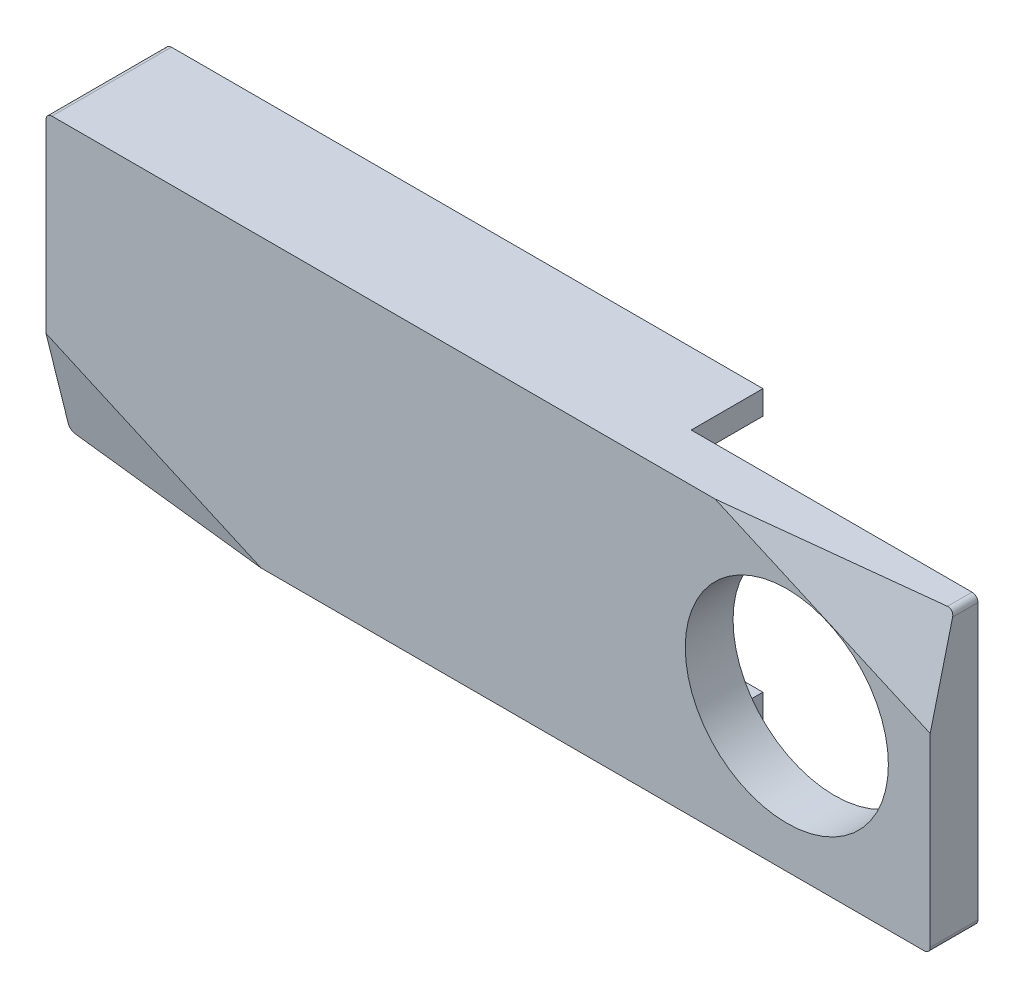
from build123d import *

# Parameters (mm, degrees)
SKETCH_1_W          = 74
SKETCH_1_H          = 24
EXTRUDE_1_DEPTH     = 10
CHAMFER_START       = 7.716439039
CHAMFER_1_OUTLINE_W = 21
CHAMFER_1_OUTLINE_H = 12
CHAMFER_1_DEPTH     = 3.283560961
SKETCH_2_R          = 8.5
CUT_EXTRUDE_1_DEPTH = 10
SKETCH_3_W          = 24
SKETCH_3_H          = 24
CUT_EXTRUDE_2_DEPTH = 6
CHAMFER_START_2     = -24
CHAMFER_3_OUTLINE_W = 21
CHAMFER_3_OUTLINE_H = 11
CHAMFER_3_DEPTH     = 2.565447114
FILLET_1_R          = 0.5
CUT_EXTRUDE_3_DEPTH = 10
SKETCH_5_W          = 33
SKETCH_5_H          = 16
CUT_EXTRUDE_4_DEPTH = 7


with BuildPart() as part:
    # 草图1 → 凸台-拉伸1 (new body)
    with BuildSketch(Plane.XY):
        with Locations((-37, -12)):
            Rectangle(SKETCH_1_W, SKETCH_1_H)
    extrude(amount=EXTRUDE_1_DEPTH)

    # 倒角1: read off the stored shape, not the designer's step
    # 倒角1 outline → 倒角1 (cut)
    with BuildSketch(Plane(origin=(0, 0, 0), x_dir=(0.994240412860114, -0.02599321340810768, -0.1039728536324305), z_dir=(0.10717276443084896, 0.24113871996940994, 0.9645548798776378)).offset(CHAMFER_START)):
        with Locations((-9.5, -6)):
            Rectangle(CHAMFER_1_OUTLINE_W, CHAMFER_1_OUTLINE_H)
    extrude(amount=CHAMFER_1_DEPTH, mode=Mode.SUBTRACT)

    # 草图2 → 切除-拉伸1 (cut)
    with BuildSketch(Plane(origin=(0, 0, 0), x_dir=(-1, 0, 0), z_dir=(0, 0, -1))):
        with Locations((12, -12)):
            Circle(SKETCH_2_R)
    extrude(amount=-CUT_EXTRUDE_1_DEPTH, mode=Mode.SUBTRACT)

    # 草图3 → 切除-拉伸2 (cut)
    with BuildSketch(Plane(origin=(0, 0, 0), x_dir=(-1, 0, 0), z_dir=(0, 0, -1))):
        with Locations((12, -12)):
            Rectangle(SKETCH_3_W, SKETCH_3_H)
    extrude(amount=-CUT_EXTRUDE_2_DEPTH, mode=Mode.SUBTRACT)

    # 倒角3: read off the stored shape, not the designer's step
    # 倒角3 outline → 倒角3 (cut)
    with BuildSketch(Plane(origin=(0, 0, 0), x_dir=(0.994240412860114, -0.02599321340810768, 0.1039728536324305), z_dir=(0.10717276443084896, 0.24113871996940994, -0.9645548798776378)).offset(CHAMFER_START_2)):
        with Locations((-63.5, 17.5)):
            Rectangle(CHAMFER_3_OUTLINE_W, CHAMFER_3_OUTLINE_H)
    extrude(amount=CHAMFER_3_DEPTH, mode=Mode.SUBTRACT)

    # 圆角1
    fillet_1_edges = [part.edges().sort_by_distance(p)[0] for p in [
        (0, 0, 7),
        (-74, -24, 4),
        (0, -24, 8),
        (-74, 0, 5),
    ]]
    fillet(fillet_1_edges, radius=FILLET_1_R)

    # 草图4 → 切除-拉伸3 (cut, symmetric)
    with BuildSketch(Plane(origin=(0, -12, 0), x_dir=(-1, 0, 0), z_dir=(0, -1, 0))):
        Polygon((24, -6), (39, 0), (24, 0), align=None)
    extrude(amount=CUT_EXTRUDE_3_DEPTH, both=True, mode=Mode.SUBTRACT)

    # 草图5 → 切除-拉伸4 (cut)
    with BuildSketch(Plane(origin=(0, 0, 0), x_dir=(-1, 0, 0), z_dir=(0, 0, -1))):
        with Locations((57.5, -12)):
            Rectangle(SKETCH_5_W, SKETCH_5_H)
    extrude(amount=-CUT_EXTRUDE_4_DEPTH, mode=Mode.SUBTRACT)


solid = part.part
